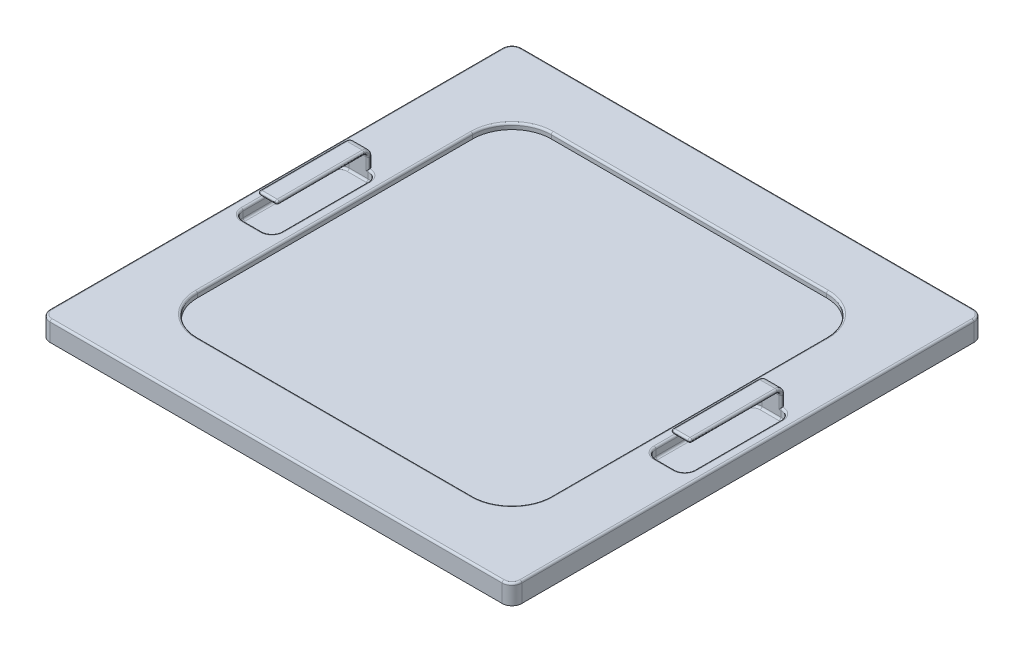
from build123d import *

# Parameters (mm, degrees)
EXTRUDE_1_DEPTH     = 10
CUT_EXTRUDE_1_DEPTH = 10
SKETCH_3_W          = 225
SKETCH_3_H          = 3.086045957
EXTRUDE_2_DEPTH     = 221
CUT_EXTRUDE_2_DEPTH = 5
SKETCH_6_W          = 9.633321968
SKETCH_6_H          = 6.578899038
EXTRUDE_3_DEPTH     = 2
EXTRUDE_4_DEPTH     = 9.63332197
FILLET_1_R          = 1
FILLET_3_R          = 1
FILLET_4_R          = 1
SKETCH_10_W         = 142.442199646
SKETCH_10_H         = 252.346997023
CUT_EXTRUDE_3_DEPTH = 36.7
FILLET_5_R          = 1
FILLET_6_R          = 1


with BuildPart() as part:
    # 草图1 → 凸台-拉伸1 (new body)
    with BuildSketch(Plane(origin=(0, 0, 0), x_dir=(1, 0, 0), z_dir=(0, 1, 0))):
        with BuildLine():
            Line((-115, -120), (115, -120))
            ThreePointArc((115, -120), (118.535533906, -118.535533906), (120, -115))
            Line((120, -115), (120, 115))
            ThreePointArc((120, 115), (118.535533906, 118.535533906), (115, 120))
            Line((115, 120), (-115, 120))
            ThreePointArc((-115, 120), (-118.535533906, 118.535533906), (-120, 115))
            Line((-120, 115), (-120, -115))
            ThreePointArc((-120, -115), (-118.535533906, -118.535533906), (-115, -120))
        make_face()
    extrude(amount=EXTRUDE_1_DEPTH)

    # 草图2 → 切除-拉伸1 (cut)
    with BuildSketch(Plane(origin=(0, 10, 0), x_dir=(1, 0, 0), z_dir=(0, 1, 0))):
        with BuildLine():
            Line((-70, -90), (70, -90))
            ThreePointArc((70, -90), (84.142135624, -84.142135624), (90, -70))
            Line((90, -70), (90, 70))
            ThreePointArc((90, 70), (84.142135624, 84.142135624), (70, 90))
            Line((70, 90), (-70, 90))
            ThreePointArc((-70, 90), (-84.142135624, 84.142135624), (-90, 70))
            Line((-90, 70), (-90, -70))
            ThreePointArc((-90, -70), (-84.142135624, -84.142135624), (-70, -90))
        make_face()
    extrude(amount=-CUT_EXTRUDE_1_DEPTH, mode=Mode.SUBTRACT)


with BuildPart() as body_2:
    # 草图3 → 凸台-拉伸2 (new body)
    with BuildSketch(Plane(origin=(0, 0, -120), x_dir=(-1, 0, 0), z_dir=(0, 0, -1))):
        with Locations((2.5, 5.600064492)):
            Rectangle(SKETCH_3_W, SKETCH_3_H)
    extrude(amount=-EXTRUDE_2_DEPTH)


with BuildPart() as cut_extrude_2_tool:
    # 草图5 → 切除-拉伸2 (new body)
    with BuildSketch(Plane(origin=(0, 10, 0), x_dir=(1, 0, 0), z_dir=(0, 1, 0))):
        with BuildLine():
            Line((-114.816660984, 21.957519092), (-114.816660984, 0))
            Line((-114.816660984, 0), (-95.183339016, 0))
            Line((-95.183339016, 0), (-95.183339016, 21.957519092))
            ThreePointArc((-95.183339016, 21.957519092), (-96.64780511, 25.493052998), (-100.183339016, 26.957519092))
            Line((-100.183339016, 26.957519092), (-109.816660984, 26.957519092))
            ThreePointArc((-109.816660984, 26.957519092), (-113.35219489, 25.493052998), (-114.816660984, 21.957519092))
        make_face()
        with BuildLine():
            Line((-95.183339016, 0), (-114.816660984, 0))
            Line((-114.816660984, 0), (-114.816660984, -21.957519092))
            ThreePointArc((-114.816660984, -21.957519092), (-113.35219489, -25.493052998), (-109.816660984, -26.957519092))
            Line((-109.816660984, -26.957519092), (-100.183339016, -26.957519092))
            ThreePointArc((-100.183339016, -26.957519092), (-96.64780511, -25.493052998), (-95.183339016, -21.957519092))
            Line((-95.183339016, -21.957519092), (-95.183339016, 0))
        make_face()
        with BuildLine():
            Line((95.183339016, 21.957519092), (95.183339016, 0))
            Line((95.183339016, 0), (114.816660984, 0))
            Line((114.816660984, 0), (114.816660984, 21.957519092))
            ThreePointArc((114.816660984, 21.957519092), (113.35219489, 25.493052998), (109.816660984, 26.957519092))
            Line((109.816660984, 26.957519092), (100.183339016, 26.957519092))
            ThreePointArc((100.183339016, 26.957519092), (96.64780511, 25.493052998), (95.183339016, 21.957519092))
        make_face()
        with BuildLine():
            ThreePointArc((95.183339016, -21.957519092), (96.64780511, -25.493052998), (100.183339016, -26.957519092))
            Line((100.183339016, -26.957519092), (109.816660984, -26.957519092))
            ThreePointArc((109.816660984, -26.957519092), (113.35219489, -25.493052998), (114.816660984, -21.957519092))
            Line((114.816660984, -21.957519092), (114.816660984, 0))
            Line((114.816660984, 0), (95.183339016, 0))
            Line((95.183339016, 0), (95.183339016, -21.957519092))
        make_face()
    extrude(amount=-CUT_EXTRUDE_2_DEPTH)


with BuildPart() as part_1:
    add(part.part)

    # 切除-拉伸2: cut by cut_extrude_2_tool
    add(cut_extrude_2_tool.part, mode=Mode.SUBTRACT)



with BuildPart() as body_2_1:
    add(body_2.part)

    # 切除-拉伸2: cut by cut_extrude_2_tool
    add(cut_extrude_2_tool.part, mode=Mode.SUBTRACT)


with BuildPart() as part_2:
    add(part_1.part)

    add(body_2_1.part)  # 凸台-拉伸3 merges body 2
    # 草图6 → 凸台-拉伸3 (add)
    with BuildSketch(Plane.XY.offset(-26.957519092)):
        with Locations((-105, 10.432536989)):
            Rectangle(SKETCH_6_W, SKETCH_6_H)
    extrude(amount=-EXTRUDE_3_DEPTH)

    # 草图9 → 凸台-拉伸4 (add)
    with BuildSketch(Plane.ZY.offset(109.816660984)):
        with BuildLine():
            Line((-24.957519092, 17.200103887), (19.2635004, 17.200103887))
            Line((19.2635004, 17.200103887), (19.2635004, 19.200103887))
            Line((19.2635004, 19.200103887), (-24.957519092, 19.200103887))
            ThreePointArc((-24.957519092, 19.200103887), (-27.785946217, 18.028531012), (-28.957519092, 15.200103887))
            Line((-28.957519092, 15.200103887), (-28.957519092, 13.304316338))
            Line((-28.957519092, 13.304316338), (-26.957519092, 13.304316338))
            Line((-26.957519092, 13.304316338), (-26.957519092, 15.200103887))
            ThreePointArc((-26.957519092, 15.200103887), (-26.371732654, 16.61431745), (-24.957519092, 17.200103887))
        make_face()
    extrude(amount=-EXTRUDE_4_DEPTH)

    # 圆角1
    fillet_1_edges = [part_2.edges().sort_by_distance(p)[0] for p in [
        (-109.816660984, 12.600051944, -26.957519092),
        (-100.183339016, 11.860993254, -26.957519092),
        (-109.816660984, 12.600051944, -28.957519092),
        (-100.183339016, 11.860993254, -28.957519092),
        (-100.183339014, 18.200103887, 19.2635004),
        (-104.999999999, 19.200103887, 19.2635004),
        (-100.183339014, 17.200103887, -2.847009346),
        (-104.999999999, 17.200103887, 19.2635004),
        (-100.183339014, 16.61431745, -26.371732654),
        (-100.183339014, 18.028531012, -27.785946217),
        (-100.183339014, 19.200103887, -2.847009346),
        (-109.816660984, 16.61431745, -26.371732654),
        (-109.816660984, 17.200103887, -2.847009346),
        (-109.816660984, 18.200103887, 19.2635004),
        (-109.816660984, 19.200103887, -2.847009346),
        (-109.816660984, 18.028531012, -27.785946217),
    ]]
    fillet(fillet_1_edges, radius=FILLET_1_R - 0.0001)  # a hair under: the kernel refuses the full size

    # 圆角3
    fillet_3_edges = [part_2.edges().sort_by_distance(p)[0] for p in [
        (-95.183339016, 5, 0),
        (-96.64780511, 5, 25.493052998),
        (-105, 5, 26.957519092),
        (-96.64780511, 5, -25.493052998),
        (-113.35219489, 5, 25.493052998),
        (-114.816660984, 5, 0),
        (-113.35219489, 5, -25.493052998),
        (-105, 5, -26.957519092),
    ]]
    fillet(fillet_3_edges, radius=FILLET_3_R)

    # 圆角4
    fillet_4_edges = [part_2.edges().sort_by_distance(p)[0] for p in [
        (-100.683289016, 10, -26.957519092),
        (-109.316710984, 10, -26.957519092),
        (-113.35219489, 10, -25.493052998),
        (-114.816660984, 10, 0),
        (-113.35219489, 10, 25.493052998),
        (-105, 10, 26.957519092),
        (-96.64780511, 10, 25.493052998),
        (-95.183339016, 10, 0),
        (-96.64780511, 10, -25.493052998),
    ]]
    fillet(fillet_4_edges, radius=FILLET_4_R - 0.0001)  # a hair under: the kernel refuses the full size

    # 草图10 → 切除-拉伸3 (cut)
    with BuildSketch(Plane(origin=(0, 10, 0), x_dir=(1, 0, 0), z_dir=(0, 1, 0))):
        with Locations((71.221099823, 6.173498511)):
            Rectangle(SKETCH_10_W, SKETCH_10_H)
    extrude(amount=-CUT_EXTRUDE_3_DEPTH, mode=Mode.SUBTRACT)

    # 镜向1: part across plane


with BuildPart() as part_3:
    add(part_2.part)
    add(part_2.part.mirror(Plane(origin=(0, -26.7, 120), x_dir=(0, 0, 1), z_dir=(-1, 0, 0))))

    # 圆角5
    fillet_5_edges = [part_3.edges().sort_by_distance(p)[0] for p in [
        (-118.535533906, 10, -118.535533906),
        (-120, 10, 0),
        (0, 10, -120),
        (118.535533906, 10, 118.535533906),
        (118.535533906, 10, -118.535533906),
        (120, 10, 0),
        (-118.535533906, 10, 118.535533906),
        (0, 10, 120),
    ]]
    fillet(fillet_5_edges, radius=FILLET_5_R)

    # 圆角6
    fillet_6_edges = [part_3.edges().sort_by_distance(p)[0] for p in [
        (-84.142135624, 0, 84.142135624),
        (-90, 0, 0),
        (-84.142135624, 0, -84.142135624),
        (0, 0, 90),
        (0, 0, -90),
        (-84.142135624, 10, 84.142135624),
        (0, 10, -90),
        (0, 10, 90),
        (-84.142135624, 10, -84.142135624),
        (-90, 10, 0),
        (84.142135624, 10, -84.142135624),
        (90, 10, 0),
        (84.142135624, 10, 84.142135624),
        (84.142135624, 0, 84.142135624),
        (90, 0, 0),
        (84.142135624, 0, -84.142135624),
    ]]
    fillet(fillet_6_edges, radius=FILLET_6_R)


solid = part_3.part
